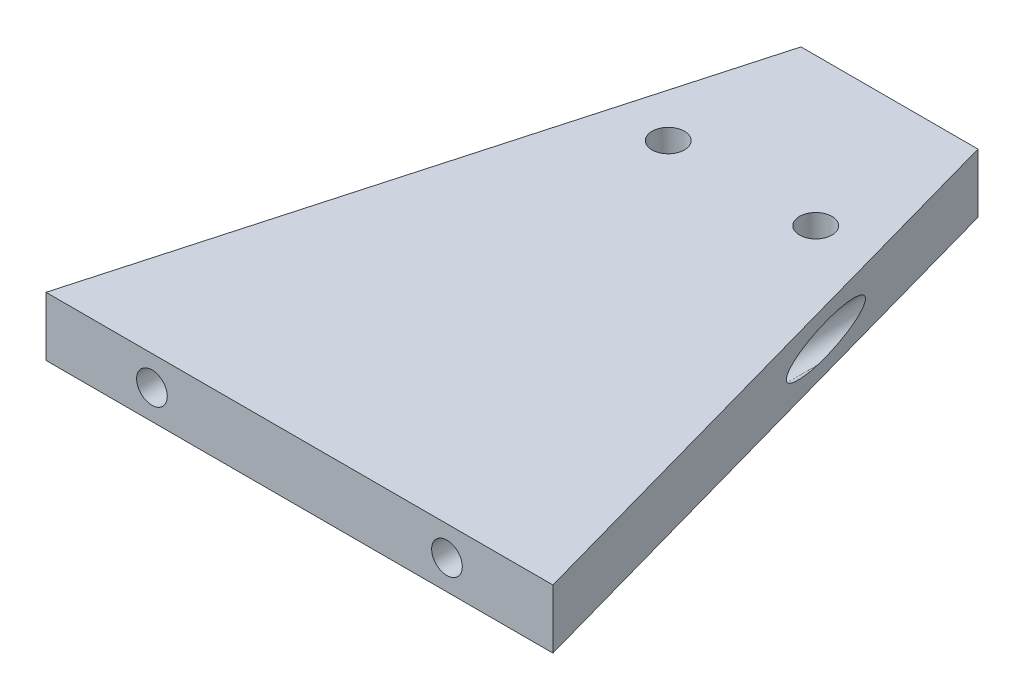
from build123d import *

# Parameters (mm, degrees)
SKETCH1_R           = 3.4925
BOSS_EXTRUDE1_DEPTH = 12.7
SKETCH3_R           = 3.302
CUT_EXTRUDE1_DEPTH  = 143.557146436
CUT_EXTRUDE2_DEPTH  = 143.557146436


with BuildPart() as part:
    # Sketch1 → Boss-Extrude1 (new body)
    with BuildSketch(Plane(origin=(0, 0, 0), x_dir=(1, 0, 0), z_dir=(0, 1, 0))):
        Polygon((0, 127), (63.5, 127), (63.5, 0), (-63.5, 0), (-63.5, 127), align=None)
        with Locations((-15.875, 95.25)):
            Circle(SKETCH1_R, mode=Mode.SUBTRACT)
        with Locations((15.875, 95.25)):
            Circle(SKETCH1_R, mode=Mode.SUBTRACT)
    extrude(amount=BOSS_EXTRUDE1_DEPTH)

    # Sketch3 → Cut-Extrude1 (cut, through all)
    with BuildSketch(Plane.XY):
        with Locations((-31.75, 6.35)):
            Circle(SKETCH3_R)
        with Locations((31.75, 6.35)):
            Circle(SKETCH3_R)
    extrude(amount=-CUT_EXTRUDE1_DEPTH, mode=Mode.SUBTRACT)

    # Sketch4 → Cut-Extrude2 (cut, through all)
    with BuildSketch(Plane(origin=(0, 12.7, 0), x_dir=(1, 0, 0), z_dir=(0, 1, 0))):
        Polygon((-63.5, -32.004), (-19.05, 127), (-63.5, 127), align=None)
        Polygon((19.05, 127), (63.5, -32.004), (63.5, 127), align=None)
    extrude(amount=-CUT_EXTRUDE2_DEPTH, mode=Mode.SUBTRACT)


solid = part.part
